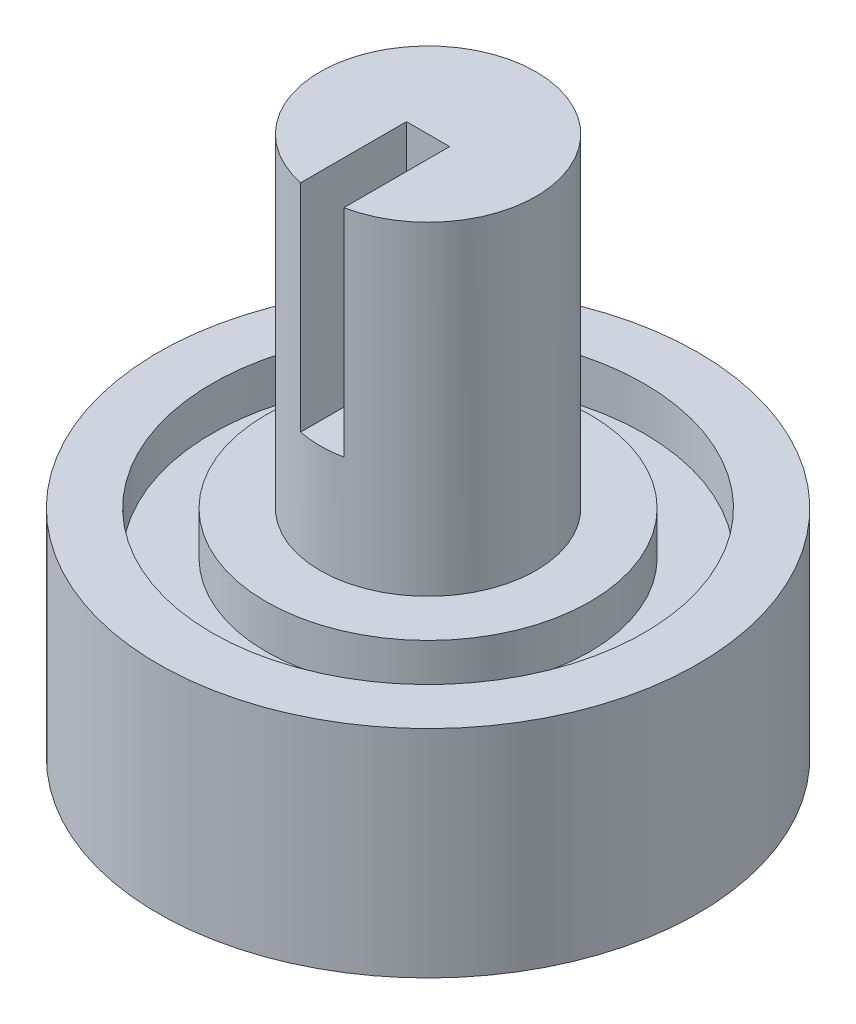
from build123d import *

# Parameters (mm, degrees)
SKETCH2_R           = 3
BOSS_EXTRUDE1_DEPTH = 1
SKETCH3_W           = 2
SKETCH3_H           = 15.596628223
CUT_EXTRUDE1_DEPTH  = 10


with BuildPart() as part:
    # Sketch1 → Revolve1 (revolve)
    with BuildSketch(Plane.XY):
        Polygon((0, 0), (2.5, 0), (2.5, 4), (7.5, 4), (7.5, 6), (10, 6), (10, 4), (12.497669608, 4), (12.497669608, 14), (10, 14), (10, 12), (7.5, 12), (7.5, 14), (5, 14), (5, 29), (0, 29), align=None)
    revolve(axis=Axis((0, 0, 0), (0, 1, 0)))

    # Sketch2 → Boss-Extrude1 (add)
    with BuildSketch(Plane.XZ.offset(-4)):
        Circle(SKETCH2_R)
    extrude(amount=BOSS_EXTRUDE1_DEPTH)

    # Sketch3 → Cut-Extrude1 (cut)
    with BuildSketch(Plane(origin=(0, 29, 0), x_dir=(1, 0, 0), z_dir=(0, 1, 0))):
        with Locations((0, -7.798314112)):
            Rectangle(SKETCH3_W, SKETCH3_H)
    extrude(amount=-CUT_EXTRUDE1_DEPTH, mode=Mode.SUBTRACT)


solid = part.part
